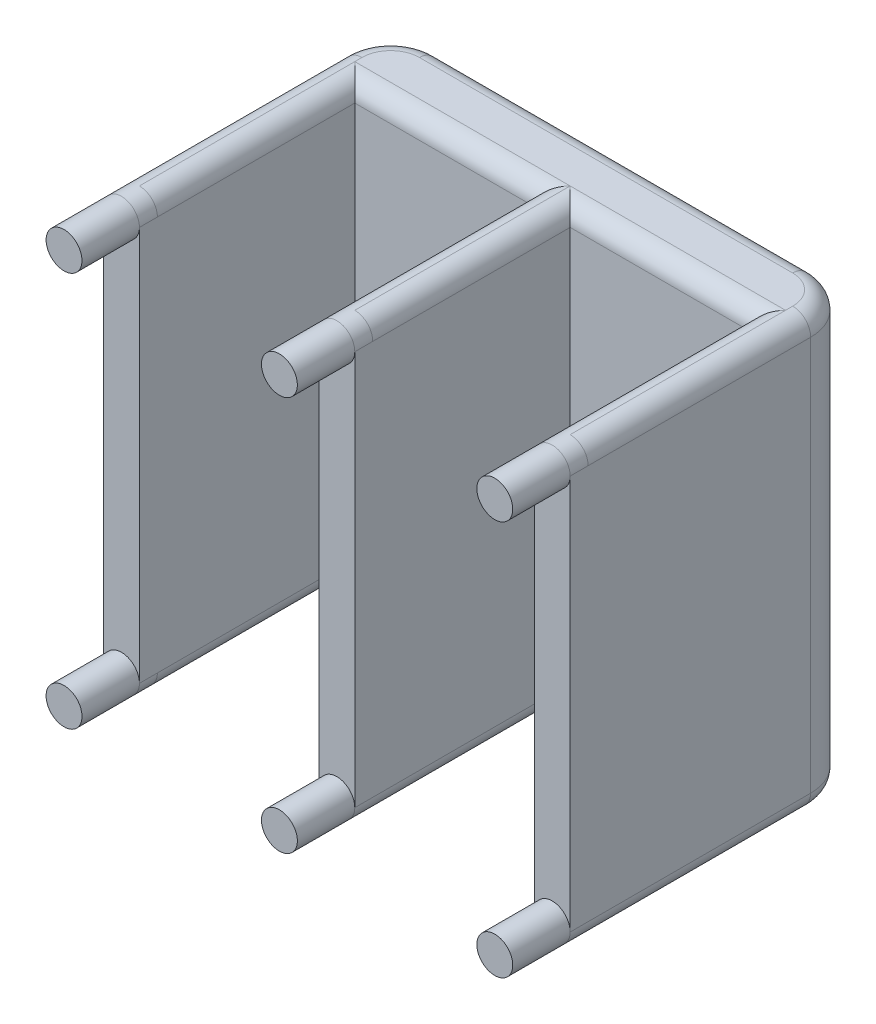
from build123d import *

# Parameters (mm, degrees)
BOSS_EXTRUDE1_DEPTH = 76.2
SKETCH3_R           = 3.175
BOSS_EXTRUDE3_DEPTH = 10.16
FILLET2_R           = 3.175
FILLET3_R           = 8.255


# Some blends are built 0.0001 mm under size
with BuildPart() as part:
    # Sketch1 → Boss-Extrude1 (new body)
    with BuildSketch(Plane(origin=(0, 0, 0), x_dir=(1, 0, 0), z_dir=(0, 1, 0))):
        Polygon((44.45, 38.1), (76.2, 38.1), (76.2, 0), (82.55, 0), (82.55, 38.1), (82.55, 50.8), (0, 50.8), (0, 38.1), (0, 0), (6.35, 0), (6.35, 38.1), (38.1, 38.1), (38.1, 0), (44.45, 0), align=None)
    extrude(amount=BOSS_EXTRUDE1_DEPTH)

    # Sketch3 → Boss-Extrude3 (add)
    with BuildSketch(Plane.XY):
        with Locations((3.175, 73.025)):
            Circle(SKETCH3_R)
        with Locations((3.175, 3.175)):
            Circle(SKETCH3_R)
        with Locations((41.275, 3.175)):
            Circle(SKETCH3_R)
        with Locations((79.375, 3.175)):
            Circle(SKETCH3_R)
        with Locations((41.275, 73.025)):
            Circle(SKETCH3_R)
        with Locations((79.375, 73.025)):
            Circle(SKETCH3_R)
    extrude(amount=BOSS_EXTRUDE3_DEPTH)

    # Fillet2
    fillet2_edges = [part.edges().sort_by_distance(p)[0] for p in [
        (6.35, 0, -19.05),
        (22.225, 0, -38.1),
        (38.1, 0, -19.05),
        (44.45, 0, -19.05),
        (60.325, 0, -38.1),
        (76.2, 0, -19.05),
        (82.55, 0, -25.4),
        (41.275, 0, -50.8),
        (0, 0, -25.4),
        (41.275, 76.2, -50.8),
        (82.55, 76.2, -25.4),
        (76.2, 76.2, -19.05),
        (60.325, 76.2, -38.1),
        (44.45, 76.2, -19.05),
        (38.1, 76.2, -19.05),
        (22.225, 76.2, -38.1),
        (6.35, 76.2, -19.05),
        (0, 76.2, -25.4),
    ]]
    fillet(fillet2_edges, radius=FILLET2_R - 0.0001)  # a hair under: the kernel refuses the full size

    # Fillet3
    # the kernel refuses this fillet: 8.255 mm, written as the material it takes off along each edge
    with BuildSketch(Plane(origin=(74.295, 0, -42.545), x_dir=(0, 0, -1), z_dir=(-1, 0, 0))) as fillet3_piece_1:
        with BuildLine():
            CenterArc((5.0801, -3.1749), 3.1749, 0, 90)
            Line((8.255, -3.1749), (8.255, 0))
            Line((8.255, 0), (5.0801, 0))
        make_face()
    revolve(axis=Axis((74.295, 0, -42.545), (0, -1, 0)), revolution_arc=90, mode=Mode.SUBTRACT)
    with BuildSketch(Plane(origin=(8.255, 0, -42.545), x_dir=(-1, 0, 0), z_dir=(0, 0, 1))) as fillet3_piece_2:
        with BuildLine():
            CenterArc((5.0801, -3.1749), 3.1749, 0, 90)
            Line((8.255, -3.1749), (8.255, 0))
            Line((8.255, 0), (5.0801, 0))
        make_face()
    revolve(axis=Axis((8.255, 0, -42.545), (0, -1, 0)), revolution_arc=90, mode=Mode.SUBTRACT)
    with BuildSketch(Plane(origin=(74.295, 76.2, -42.545), x_dir=(1, 0, 0), z_dir=(0, 0, 1))) as fillet3_piece_3:
        with BuildLine():
            CenterArc((5.0801, -3.1749), 3.1749, 0, 90)
            Line((8.255, -3.1749), (8.255, 0))
            Line((8.255, 0), (5.0801, 0))
        make_face()
    revolve(axis=Axis((74.295, 76.2, -42.545), (0, 1, 0)), revolution_arc=90, mode=Mode.SUBTRACT)
    with BuildSketch(Plane(origin=(8.255, 76.2, -42.545), x_dir=(0, 0, -1), z_dir=(1, 0, 0))) as fillet3_piece_4:
        with BuildLine():
            CenterArc((5.0801, -3.1749), 3.1749, 0, 90)
            Line((8.255, -3.1749), (8.255, 0))
            Line((8.255, 0), (5.0801, 0))
        make_face()
    revolve(axis=Axis((8.255, 76.2, -42.545), (0, 1, 0)), revolution_arc=90, mode=Mode.SUBTRACT)
    with BuildSketch(Plane(origin=(0, 0, -50.8), x_dir=(1, 0, 0), z_dir=(0, 1, 0)), Plane(origin=(82.55, 0, -50.8), x_dir=(0, 0, 1), z_dir=(0, 1, 0))) as fillet3_piece_5:
        with BuildLine():
            CenterArc((FILLET3_R, -FILLET3_R), FILLET3_R, 90, 90)
            Line((0, -FILLET3_R), (0, 0))
            Line((0, 0), (FILLET3_R, 0))
        make_face()
    extrude(amount=76.2, mode=Mode.SUBTRACT)


solid = part.part
